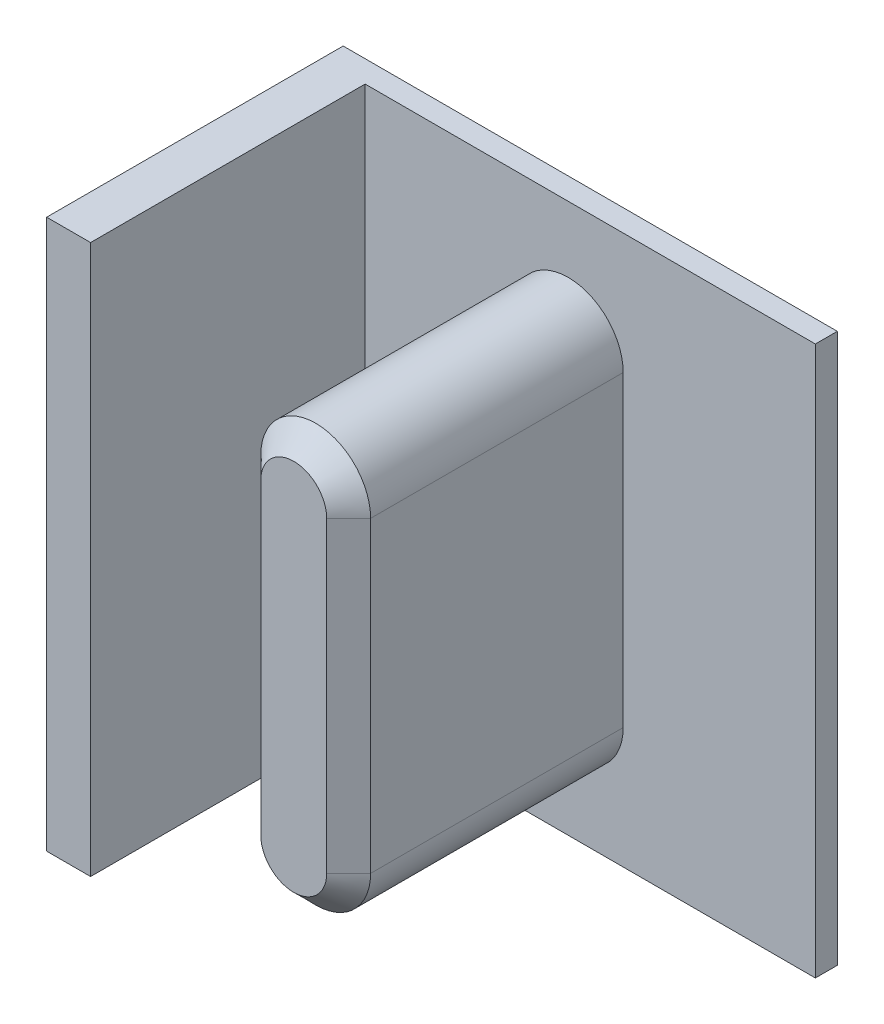
from build123d import *

# Parameters (mm, degrees)
SKETCH1_W           = 9
SKETCH1_H           = 10
BOSS_EXTRUDE1_DEPTH = 0.4
BOSS_EXTRUDE2_DEPTH = 5
SKETCH4_W           = 0.8
SKETCH4_H           = 10
BOSS_EXTRUDE3_DEPTH = 5
CHAMFER1_SIZE       = 0.4


with BuildPart() as part:
    # Sketch1 → Boss-Extrude1 (new body)
    with BuildSketch(Plane.XY):
        with Locations((4.5, 5)):
            Rectangle(SKETCH1_W, SKETCH1_H)
    extrude(amount=BOSS_EXTRUDE1_DEPTH)

    # Sketch3 → Boss-Extrude2 (add)
    with BuildSketch(Plane.XY.offset(0.4)):
        with BuildLine():
            Line((3.5, 2.2), (3.5, 7.8))
            ThreePointArc((3.5, 7.8), (4.5, 8.8), (5.5, 7.8))
            Line((5.5, 7.8), (5.5, 2.2))
            ThreePointArc((5.5, 2.2), (4.5, 1.2), (3.5, 2.2))
        make_face()
    extrude(amount=BOSS_EXTRUDE2_DEPTH)

    # Sketch4 → Boss-Extrude3 (add)
    with BuildSketch(Plane.XY.offset(0.4)):
        with Locations((0.4, 5)):
            Rectangle(SKETCH4_W, SKETCH4_H)
    extrude(amount=BOSS_EXTRUDE3_DEPTH)

    # Chamfer1
    chamfer1_edges = [part.edges().sort_by_distance(p)[0] for p in [
        (3.5, 5, 5.4),
        (4.5, 8.8, 5.4),
        (5.5, 5, 5.4),
        (4.5, 1.2, 5.4),
    ]]
    chamfer(chamfer1_edges, length=CHAMFER1_SIZE)


solid = part.part
